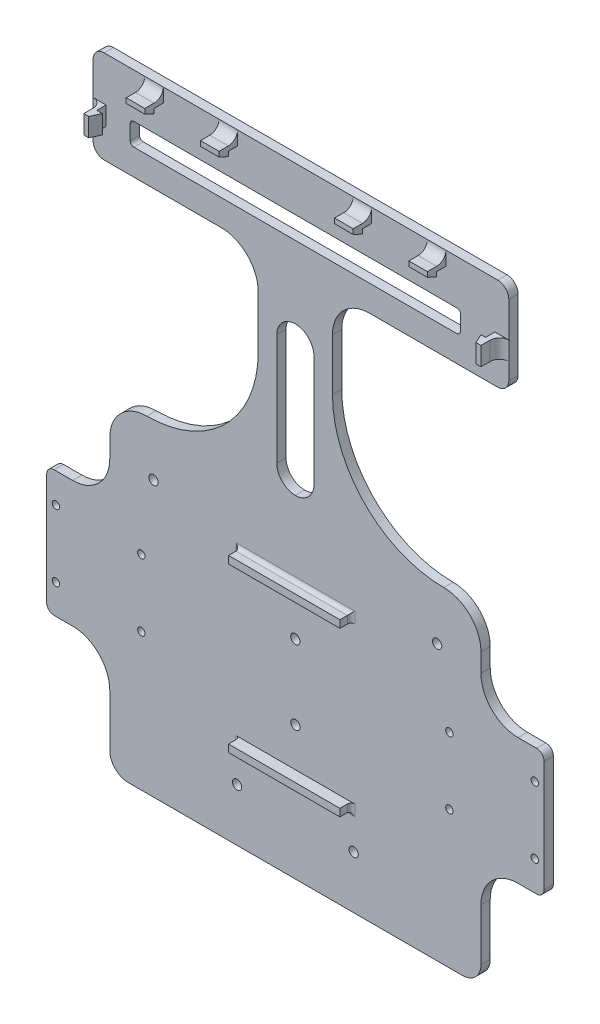
from build123d import *
from OCP.BRepFilletAPI import BRepFilletAPI_MakeChamfer

# Parameters (mm, degrees)
SALIENTE_EXTRUIR1_DEPTH      = 2.5
REDONDEO1_R                  = 10
REDONDEO2_R                  = 30
REDONDEO3_R                  = 5
REDONDEO4_R                  = 2
CROQUIS2_R                   = 1.25
CORTAR_EXTRUIR1_DEPTH        = 2.5
CROQUIS3_W                   = 30
CROQUIS3_H                   = 2
SALIENTE_EXTRUIR2_DEPTH      = 3
CROQUIS4_R                   = 1
CROQUIS4_R_2                 = 1.25
CORTAR_EXTRUIR2_DEPTH        = 2.5
CROQUIS5_R                   = 1.25
CORTAR_EXTRUIR3_DEPTH        = 2.5
CROQUIS6_W                   = 30
CROQUIS6_H                   = 2
SALIENTE_EXTRUIR3_DEPTH      = 3
REDONDEO5_R                  = 1
SALIENTE_EXTRUIR6_DEPTH      = 2.5
REDONDEO7_R                  = 10
REDONDEO8_R                  = 3
CROQUIS8_W                   = 89
CROQUIS8_H                   = 6
CORTAR_EXTRUIR5_DEPTH        = 2.5
REDONDEO10_R                 = 1
CROQUIS9_W                   = 2.5
CROQUIS9_H                   = 5
SALIENTE_EXTRUIR7_DEPTH      = 5
REDONDEO11_R                 = 2.5
CROQUIS10_W                  = 1.5
CROQUIS10_H                  = 5
CORTAR_EXTRUIR6_DEPTH        = 2.5
CHAFL_N1_SIZE2               = 2.5
CHAFL_N1_SIZE                = 1.165769145
CROQUIS11_W                  = 2.5
CROQUIS11_H                  = 5
SALIENTE_EXTRUIR8_DEPTH      = 5
CROQUIS12_W                  = 1.25
CROQUIS12_H                  = 5
CORTAR_EXTRUIR7_DEPTH        = 2.5
CHAFL_N2_SIZE2               = 1.165769145
CHAFL_N2_SIZE                = 2.5
REDONDEO13_R                 = 2.5
CROQUIS13_W                  = 5
CROQUIS13_H                  = 2.5
SALIENTE_EXTRUIR9_DEPTH      = 5
REDONDEO14_R                 = 2.5
CROQUIS14_W                  = 5
CROQUIS14_H                  = 1.25
CORTAR_EXTRUIR8_DEPTH        = 2.5
CHAFL_N3_SIZE                = 1.165769145
CHAFL_N3_SIZE_2              = 2.5
REDONDEO14_OF_SIMETR_A4_R    = 2.5
CHAFL_N3_OF_SIMETR_A4_SIZE   = 1.165769145
CHAFL_N3_OF_SIMETR_A4_SIZE_2 = 2.5
CROQUIS17_W                  = 10
CROQUIS17_H                  = 40
CORTAR_EXTRUIR9_DEPTH        = 2.5
REDONDEO19_R                 = 5


with BuildPart() as part:
    # Croquis1 → Saliente-Extruir1 (new body)
    with BuildSketch(Plane.XY):
        Polygon((10, 22.5), (10, 65.5), (-10, 65.5), (-10, 22.5), (-50, 22.5), (-50, -2.5), (-67, -2.5), (-67, -36.5), (-50, -36.5), (-50, -65.5), (50, -65.5), (50, -36.5), (67, -36.5), (67, -2.5), (50, -2.5), (50, 22.5), align=None)
    extrude(amount=SALIENTE_EXTRUIR1_DEPTH)

    # Redondeo1
    redondeo1_edges = [part.edges().sort_by_distance(p)[0] for p in [
        (-50, -36.5, 1.25),
        (-50, -2.5, 1.25),
        (-50, 22.5, 1.25),
        (50, 22.5, 1.25),
        (50, -2.5, 1.25),
        (50, -36.5, 1.25),
    ]]
    fillet(redondeo1_edges, radius=REDONDEO1_R)

    # Redondeo2
    redondeo2_edges = [part.edges().sort_by_distance(p)[0] for p in [
        (10, 22.5, 1.25),
        (-10, 22.5, 1.25),
    ]]
    fillet(redondeo2_edges, radius=REDONDEO2_R - 0.0001)  # a hair under: the kernel refuses the full size

    # Redondeo3
    redondeo3_edges = [part.edges().sort_by_distance(p)[0] for p in [
        (50, -65.5, 1.25),
        (-50, -65.5, 1.25),
    ]]
    fillet(redondeo3_edges, radius=REDONDEO3_R)

    # Redondeo4
    redondeo4_edges = [part.edges().sort_by_distance(p)[0] for p in [
        (-67, -36.5, 1.25),
        (-67, -2.5, 1.25),
        (67, -2.5, 1.25),
        (67, -36.5, 1.25),
    ]]
    fillet(redondeo4_edges, radius=REDONDEO4_R)

    # Croquis2 → Cortar-Extruir1 (cut)
    with BuildSketch(Plane(origin=(0, 0, 0), x_dir=(-1, 0, 0), z_dir=(0, 0, -1))):
        with Locations((-15.7, -51.32)):
            Circle(CROQUIS2_R)
    cortar_extruir1 = extrude(amount=-CORTAR_EXTRUIR1_DEPTH, mode=Mode.SUBTRACT)

    # Simetría1: Cortar-Extruir1 across plane
    add(cortar_extruir1.mirror(Plane(origin=(0, 0, 0), x_dir=(0, 0, 1), z_dir=(1, 0, 0))), mode=Mode.SUBTRACT)

    # Croquis3 → Saliente-Extruir2 (add)
    with BuildSketch(Plane.XY.offset(2.5)):
        with Locations((0, -41)):
            Rectangle(CROQUIS3_W, CROQUIS3_H)
    extrude(amount=SALIENTE_EXTRUIR2_DEPTH)

    # Croquis4 → Cortar-Extruir2 (cut)
    with BuildSketch(Plane.XY.offset(2.5)):
        with Locations((64.5, -28.5)):
            Circle(CROQUIS4_R)
        with Locations((64.5, -10.5)):
            Circle(CROQUIS4_R)
        with Locations((41.5, -28.5)):
            Circle(CROQUIS4_R)
        with Locations((41.5, -10.5)):
            Circle(CROQUIS4_R)
        with Locations((0, -9.5)):
            Circle(CROQUIS4_R_2)
        with Locations((0, -29.5)):
            Circle(CROQUIS4_R_2)
    cortar_extruir2 = extrude(amount=-CORTAR_EXTRUIR2_DEPTH, mode=Mode.SUBTRACT)

    # Simetría2: Cortar-Extruir2 across plane
    add(cortar_extruir2.mirror(Plane(origin=(0, 0, 0), x_dir=(0, 0, 1), z_dir=(1, 0, 0))), mode=Mode.SUBTRACT)

    # Croquis5 → Cortar-Extruir3 (cut)
    with BuildSketch(Plane.XY.offset(2.5)):
        with Locations((38.2, 8.5)):
            Circle(CROQUIS5_R)
    cortar_extruir3 = extrude(amount=-CORTAR_EXTRUIR3_DEPTH, mode=Mode.SUBTRACT)

    # Simetría3: Cortar-Extruir3 across plane
    add(cortar_extruir3.mirror(Plane(origin=(0, 0, 0), x_dir=(0, 0, 1), z_dir=(1, 0, 0))), mode=Mode.SUBTRACT)

    # Croquis6 → Saliente-Extruir3 (add)
    with BuildSketch(Plane.XY.offset(2.5)):
        with Locations((0, 3)):
            Rectangle(CROQUIS6_W, CROQUIS6_H)
    extrude(amount=SALIENTE_EXTRUIR3_DEPTH)

    # Redondeo5
    redondeo5_edges = [part.edges().sort_by_distance(p)[0] for p in [
        (-15, -41, 2.5),
        (0, -42, 2.5),
        (15, -41, 2.5),
        (-15, 3, 2.5),
        (15, 3, 2.5),
        (0, 4, 2.5),
    ]]
    fillet(redondeo5_edges, radius=REDONDEO5_R)

    # Croquis7 → Saliente-Extruir6 (add)
    with BuildSketch(Plane.XY.offset(2.5)):
        Polygon((10, 65.5), (10, 76.5), (57.5, 76.5), (57.5, 101.5), (-54.5, 101.5), (-54.5, 76.5), (-10, 76.5), (-10, 65.5), align=None)
    extrude(amount=-SALIENTE_EXTRUIR6_DEPTH)

    # Redondeo7
    redondeo7_edges = [part.edges().sort_by_distance(p)[0] for p in [
        (10, 76.5, 1.25),
        (-10, 76.5, 1.25),
    ]]
    fillet(redondeo7_edges, radius=REDONDEO7_R)

    # Redondeo8
    redondeo8_edges = [part.edges().sort_by_distance(p)[0] for p in [
        (-54.5, 76.5, 1.25),
        (-54.5, 101.5, 1.25),
        (57.5, 101.5, 1.25),
        (57.5, 76.5, 1.25),
    ]]
    fillet(redondeo8_edges, radius=REDONDEO8_R)

    # Croquis8 → Cortar-Extruir5 (cut)
    with BuildSketch(Plane.XY.offset(2.5)):
        with Locations((0, 86.5)):
            Rectangle(CROQUIS8_W, CROQUIS8_H)
    extrude(amount=-CORTAR_EXTRUIR5_DEPTH, mode=Mode.SUBTRACT)

    # Redondeo10
    redondeo10_edges = [part.edges().sort_by_distance(p)[0] for p in [
        (-44.5, 83.5, 1.25),
        (-44.5, 89.5, 1.25),
        (44.5, 89.5, 1.25),
        (44.5, 83.5, 1.25),
    ]]
    fillet(redondeo10_edges, radius=REDONDEO10_R)

    # Croquis9 → Saliente-Extruir7 (add)
    with BuildSketch(Plane.XY.offset(2.5)):
        with Locations((-50.75, 87.094539416)):
            Rectangle(CROQUIS9_W, CROQUIS9_H)
    extrude(amount=SALIENTE_EXTRUIR7_DEPTH)

    # Redondeo11
    redondeo11_edges = [part.edges().sort_by_distance(p)[0] for p in [
        (-52, 87.094539416, 2.5),
    ]]
    fillet(redondeo11_edges, radius=REDONDEO11_R - 0.0001)  # a hair under: the kernel refuses the full size

    # Croquis10 → Cortar-Extruir6 (cut)
    with BuildSketch(Plane.XY.offset(2.5)):
        with Locations((-50.25, 87.094539416)):
            Rectangle(CROQUIS10_W, CROQUIS10_H)
    extrude(amount=CORTAR_EXTRUIR6_DEPTH, mode=Mode.SUBTRACT)

    # Chaflán1
    chafl_n1_edges = [part.edges().sort_by_distance(p)[0] for p in [
        (-49.5, 87.094539416, 7.5),
    ]]
    chafl_n1_side = [part.faces().sort_by_distance(p)[0] for p in [
        (-49.523315383, 87.094539416, 7.5),
    ]]
    chamfer(chafl_n1_edges, length=CHAFL_N1_SIZE - 0.0001, length2=CHAFL_N1_SIZE2 - 0.0001, reference=chafl_n1_side[0])  # a hair under: the kernel refuses the full size

    # Croquis11 → Saliente-Extruir8 (add)
    with BuildSketch(Plane.XY.offset(2.5)):
        with Locations((53.75, 86.5)):
            Rectangle(CROQUIS11_W, CROQUIS11_H)
    extrude(amount=SALIENTE_EXTRUIR8_DEPTH)

    # Croquis12 → Cortar-Extruir7 (cut)
    with BuildSketch(Plane.XY.offset(2.5)):
        with Locations((53.125, 86.5)):
            Rectangle(CROQUIS12_W, CROQUIS12_H)
    extrude(amount=CORTAR_EXTRUIR7_DEPTH, mode=Mode.SUBTRACT)

    # Chaflán2
    chafl_n2_edges = [part.edges().sort_by_distance(p)[0] for p in [
        (52.5, 86.5, 7.5),
    ]]
    chafl_n2_side = [part.faces().sort_by_distance(p)[0] for p in [
        (52.5, 86.5, 7.476684617),
    ]]
    chamfer(chafl_n2_edges, length=CHAFL_N2_SIZE - 0.0001, length2=CHAFL_N2_SIZE2 - 0.0001, reference=chafl_n2_side[0])  # a hair under: the kernel refuses the full size

    # Redondeo13
    redondeo13_edges = [part.edges().sort_by_distance(p)[0] for p in [
        (55, 86.5, 2.5),
    ]]
    fillet(redondeo13_edges, radius=REDONDEO13_R - 0.0001)  # a hair under: the kernel refuses the full size

    # Croquis13 → Saliente-Extruir9 (add)
    with BuildSketch(Plane.XY.offset(2.5)):
        with Locations((-38.066978344, 97.75)):
            Rectangle(CROQUIS13_W, CROQUIS13_H)
        with Locations((-18.066978344, 97.75)):
            Rectangle(CROQUIS13_W, CROQUIS13_H)
    saliente_extruir9 = extrude(amount=SALIENTE_EXTRUIR9_DEPTH)

    # Redondeo14
    redondeo14_edges = [part.edges().sort_by_distance(p)[0] for p in [
        (-38.066978344, 99, 2.5),
        (-18.066978344, 99, 2.5),
    ]]
    fillet(redondeo14_edges, radius=REDONDEO14_R - 0.0001)  # a hair under: the kernel refuses the full size

    # Croquis14 → Cortar-Extruir8 (cut)
    with BuildSketch(Plane.XY.offset(2.5)):
        with Locations((-38.066978344, 97.125)):
            Rectangle(CROQUIS14_W, CROQUIS14_H)
        with Locations((-18.066978344, 97.125)):
            Rectangle(CROQUIS14_W, CROQUIS14_H)
    cortar_extruir8 = extrude(amount=CORTAR_EXTRUIR8_DEPTH, mode=Mode.SUBTRACT)

    # Chaflán3
    chafl_n3_edges_1 = [part.edges().sort_by_distance(p)[0] for p in [
        (-18.066978344, 96.5, 7.5),
    ]]
    chafl_n3_side_1 = [part.faces().sort_by_distance(p)[0] for p in [
        (-18.066978344, 96.523315383, 7.5),
    ]]
    chafl_n3_edges_2 = [part.edges().sort_by_distance(p)[0] for p in [
        (-38.066978344, 96.5, 7.5),
    ]]
    chafl_n3_side_2 = [part.faces().sort_by_distance(p)[0] for p in [
        (-38.066978344, 96.523315383, 7.5),
    ]]
    chafl_n3 = BRepFilletAPI_MakeChamfer(part.part.solid().wrapped)
    for e in chafl_n3_edges_1:
        chafl_n3.Add(CHAFL_N3_SIZE - 0.0001, CHAFL_N3_SIZE_2 - 0.0001, e.wrapped, chafl_n3_side_1[0].wrapped)
    for e in chafl_n3_edges_2:
        chafl_n3.Add(CHAFL_N3_SIZE - 0.0001, CHAFL_N3_SIZE_2 - 0.0001, e.wrapped, chafl_n3_side_2[0].wrapped)
    add(Compound.cast(chafl_n3.Shape()), mode=Mode.REPLACE)  # a hair under: the kernel refuses the full size

    # Simetría4: Saliente-Extruir9, Cortar-Extruir8 across plane
    add(saliente_extruir9.mirror(Plane(origin=(0, 0, 0), x_dir=(0, 0, 1), z_dir=(1, 0, 0))))
    add(cortar_extruir8.mirror(Plane(origin=(0, 0, 0), x_dir=(0, 0, 1), z_dir=(1, 0, 0))), mode=Mode.SUBTRACT)

    # Redondeo14 of Simetría4
    redondeo14_of_simetr_a4_edges = [part.edges().sort_by_distance(p)[0] for p in [
        (38.066978344, 99, 2.5),
        (18.066978344, 99, 2.5),
    ]]
    fillet(redondeo14_of_simetr_a4_edges, radius=REDONDEO14_OF_SIMETR_A4_R - 0.0001)  # a hair under: the kernel refuses the full size

    # Chaflán3 of Simetría4
    chafl_n3_of_simetr_a4_edges_1 = [part.edges().sort_by_distance(p)[0] for p in [
        (18.066978344, 96.5, 7.5),
    ]]
    chafl_n3_of_simetr_a4_side_1 = [part.faces().sort_by_distance(p)[0] for p in [
        (18.066978344, 96.523315383, 7.5),
    ]]
    chafl_n3_of_simetr_a4_edges_2 = [part.edges().sort_by_distance(p)[0] for p in [
        (38.066978344, 96.5, 7.5),
    ]]
    chafl_n3_of_simetr_a4_side_2 = [part.faces().sort_by_distance(p)[0] for p in [
        (38.066978344, 96.523315383, 7.5),
    ]]
    chafl_n3_of_simetr_a4 = BRepFilletAPI_MakeChamfer(part.part.solid().wrapped)
    for e in chafl_n3_of_simetr_a4_edges_1:
        chafl_n3_of_simetr_a4.Add(CHAFL_N3_OF_SIMETR_A4_SIZE - 0.0001, CHAFL_N3_OF_SIMETR_A4_SIZE_2 - 0.0001, e.wrapped, chafl_n3_of_simetr_a4_side_1[0].wrapped)
    for e in chafl_n3_of_simetr_a4_edges_2:
        chafl_n3_of_simetr_a4.Add(CHAFL_N3_OF_SIMETR_A4_SIZE - 0.0001, CHAFL_N3_OF_SIMETR_A4_SIZE_2 - 0.0001, e.wrapped, chafl_n3_of_simetr_a4_side_2[0].wrapped)
    add(Compound.cast(chafl_n3_of_simetr_a4.Shape()), mode=Mode.REPLACE)  # a hair under: the kernel refuses the full size

    # Croquis17 → Cortar-Extruir9 (cut)
    with BuildSketch(Plane.XY.offset(2.5)):
        with Locations((0, 44)):
            Rectangle(CROQUIS17_W, CROQUIS17_H)
    extrude(amount=-CORTAR_EXTRUIR9_DEPTH, mode=Mode.SUBTRACT)

    # Redondeo19
    redondeo19_edges = [part.edges().sort_by_distance(p)[0] for p in [
        (-5, 24, 1.25),
        (5, 24, 1.25),
        (5, 64, 1.25),
        (-5, 64, 1.25),
    ]]
    fillet(redondeo19_edges, radius=REDONDEO19_R - 0.0001)  # a hair under: the kernel refuses the full size


solid = part.part
